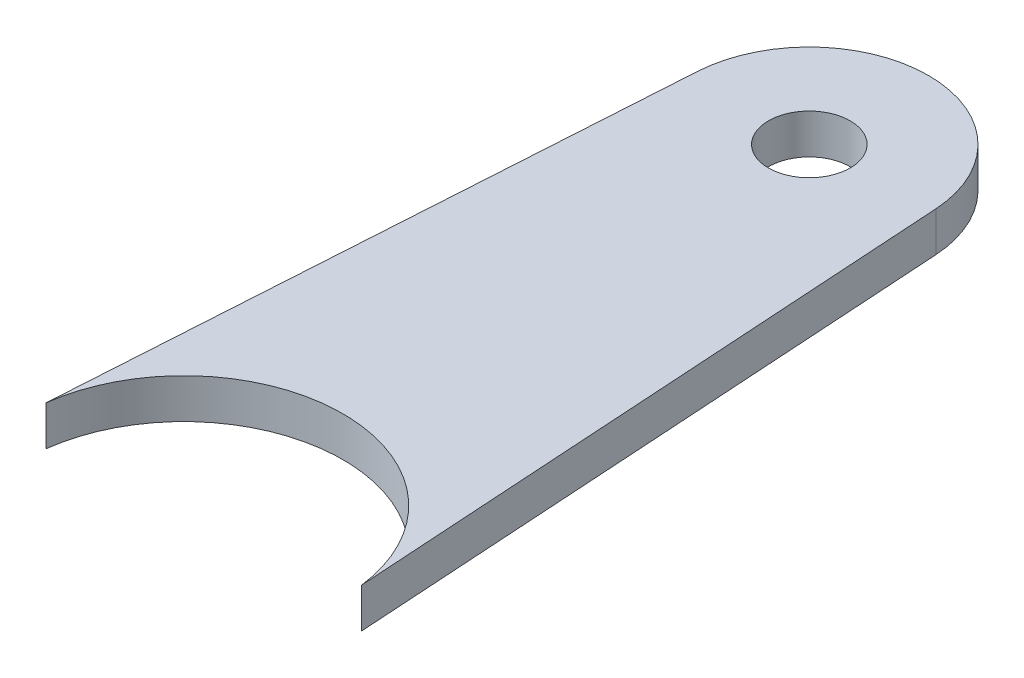
from build123d import *

# Parameters (mm, degrees)
SKETCH1_R           = 3.2639
BOSS_EXTRUDE1_DEPTH = 3.175


with BuildPart() as part:
    # Sketch1 → Boss-Extrude1 (new body)
    with BuildSketch(Plane(origin=(0, 0, 0), x_dir=(1, 0, 0), z_dir=(0, 1, 0))):
        with BuildLine():
            Line((3.19396596, 50.537184344), (0.10105108, 1.598901536))
            ThreePointArc((0.10105108, 1.598901536), (12.7, 12.7), (25.29894892, 1.598901536))
            Line((25.29894892, 1.598901536), (22.20603404, 50.537184344))
            ThreePointArc((22.20603404, 50.537184344), (12.7, 59.4614), (3.19396596, 50.537184344))
        make_face()
        with Locations((12.7, 49.9364)):
            Circle(SKETCH1_R, mode=Mode.SUBTRACT)
    extrude(amount=BOSS_EXTRUDE1_DEPTH)


solid = part.part
